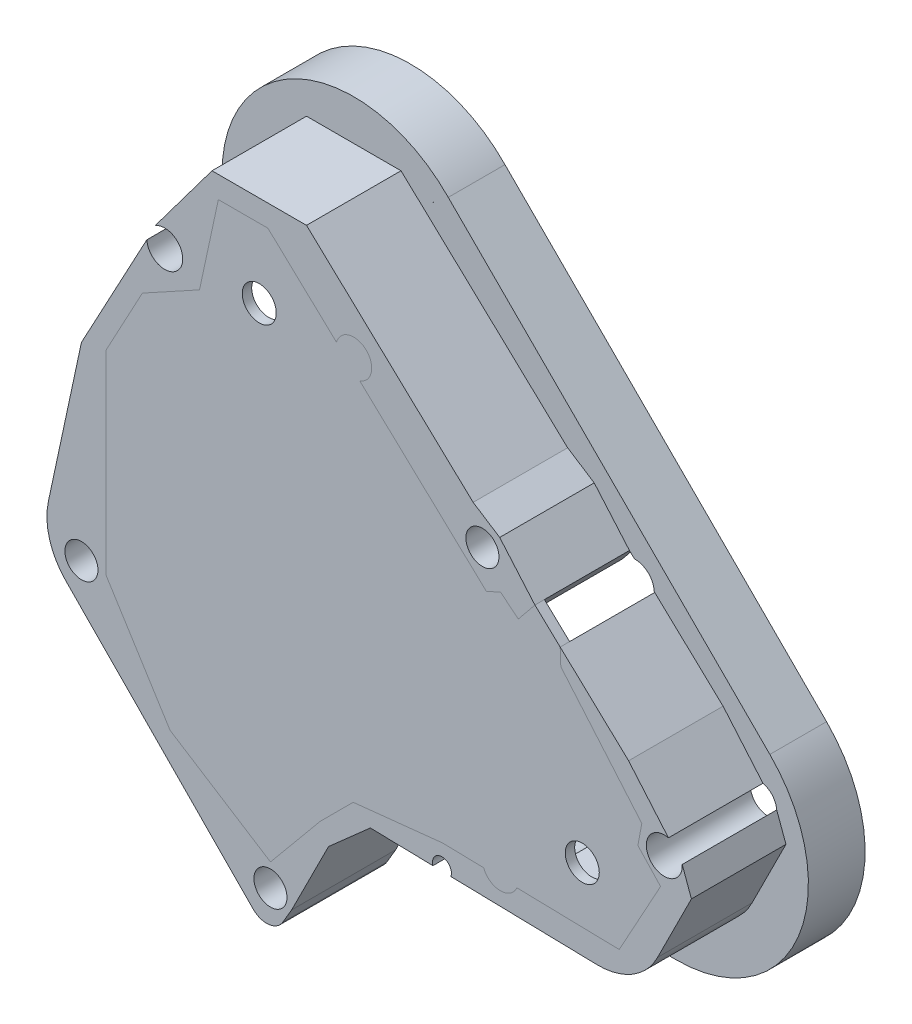
from build123d import *

# Parameters (mm, degrees)
SKETCH1_R                = 4.445
BOSS_EXTRUDE1_DEPTH      = 27.94
SKETCH1_4_R              = 4.445
SKETCH1_4_R_2            = 2.032
SKETCH1_4_R_3            = 2.0193
BOSS_EXTRUDE2_DEPTH      = 5.08
BOSS_EXTRUDE3_DEPTH      = 2.54
BOSS_EXTRUDE4_DEPTH      = 2.54
BOSS_EXTRUDE4_DEPTH_BACK = 12.7
BOSS_EXTRUDE5_DEPTH      = 2.54
CUT_EXTRUDE2_DEPTH       = 176.272405321
BOSS_EXTRUDE7_DEPTH      = 2.54
SKETCH1_7_R              = 4.572
CUT_EXTRUDE1_DEPTH       = 176.272405321
BOSS_EXTRUDE6_DEPTH      = 2.54


with BuildPart() as part:
    # Sketch1 → Boss-Extrude1 (new body)
    with BuildSketch(Plane.XY):
        with BuildLine():
            ThreePointArc((-56.507300171, 12.537235488), (-56.195803813, 3.848751471), (-51.801985551, -3.653324614))
            Line((-51.801985551, -3.653324614), (-1.47570348, -54.850767255))
            ThreePointArc((-1.47570348, -54.850767255), (2.772016994, -56.331034197), (6.529742955, -53.858421196))
            Line((6.529742955, -53.858421196), (8.86743597, -49.87006403))
            Line((8.86743597, -49.87006403), (18.794900521, -30.155662993))
            Line((18.794900521, -30.155662993), (30.015464801, -20.224261861))
            Line((30.015464801, -20.224261861), (90.906521033, -21.585518505))
            ThreePointArc((90.906521033, -21.585518505), (100.475537269, -19.041819588), (107.200283399, -11.7744772))
            Line((107.200283399, -11.7744772), (116.311189347, 6.409978492))
            Line((116.311189347, 6.409978492), (113.829291982, 13.184806868))
            ThreePointArc((113.829291982, 13.184806868), (105.340047507, 9.70868308), (110.132255745, 17.530795873))
            Line((110.132255745, 17.530795873), (99.420817942, 30.122447115))
            Line((99.420817942, 30.122447115), (81.037096807, 47.39593724))
            Line((81.037096807, 47.39593724), (81.2028603, 42.898970903))
            Line((81.2028603, 42.898970903), (102.978646989, 17.30080971))
            Line((102.978646989, 17.30080971), (101.915981854, 11.639329767))
            Line((101.915981854, 11.639329767), (108.017908886, 5.157985196))
            Line((108.017908886, 5.157985196), (96.90201237, -15.075571619))
            Line((96.90201237, -15.075571619), (69.399721914, -14.460741167))
            ThreePointArc((69.399721914, -14.460741167), (64.864546386, -17.364816007), (60.463681575, -14.260970544))
            Line((60.463681575, -14.260970544), (49.393136216, -14.01348176))
            Line((49.393136216, -14.01348176), (25.4, -16.5608))
            Line((25.4, -16.5608), (16.5608, -25.4))
            Line((16.5608, -25.4), (3.175, -41.558795918))
            Line((3.175, -41.558795918), (-23.8101989, -24.409795746))
            Line((-23.8101989, -24.409795746), (-41.068354942, 3.175))
            Line((-41.068354942, 3.175), (-41.068354942, 55.377447672))
            Line((-41.068354942, 55.377447672), (-31.251976081, 73.622391025))
            Line((-31.251976081, 73.622391025), (-15.891878201, 82.061036959))
            Line((-15.891878201, 82.061036959), (-10.836023731, 105.600550299))
            Line((-10.836023731, 105.600550299), (2.486172742, 105.600550299))
            Line((2.486172742, 105.600550299), (20.916306787, 88.283450236))
            ThreePointArc((20.916306787, 88.283450236), (28.864622049, 90.486498065), (27.160323343, 82.416522777))
            Line((27.160323343, 82.416522777), (61.243243186, 50.391941083))
            Line((61.243243186, 50.391941083), (64.972407605, 52.198379473))
            Line((64.972407605, 52.198379473), (69.788594683, 48.28291809))
            Line((69.788594683, 48.28291809), (74.25115565, 53.77206135))
            Line((74.25115565, 53.77206135), (64.777919112, 64.777919112))
            Line((64.777919112, 64.777919112), (57.647971379, 69.372544921))
            Line((57.647971379, 69.372544921), (12.859978492, 111.455698118))
            Line((12.859978492, 111.455698118), (-12.540021508, 111.455698118))
            Line((-12.540021508, 111.455698118), (-27.811486315, 91.053304566))
            ThreePointArc((-27.811486315, 91.053304566), (-20.936169847, 84.786075459), (-30.05423809, 86.632414738))
            Line((-30.05423809, 86.632414738), (-47.625, 53.975))
            Line((-47.625, 53.975), (-56.507300171, 12.537235488))
        make_face()
        with Locations((3.175, -47.625)):
            Circle(SKETCH1_R, mode=Mode.SUBTRACT)
        with Locations((-47.625, 3.175)):
            Circle(SKETCH1_R, mode=Mode.SUBTRACT)
        with Locations((60.138073453, 60.138073453)):
            Circle(SKETCH1_R, mode=Mode.SUBTRACT)
    extrude(amount=BOSS_EXTRUDE1_DEPTH)

    # Sketch1<4> → Boss-Extrude2 (add)
    # profile 1 of 3: a face of its own
    with BuildSketch(Plane.XY):
        with Locations((-47.625, 3.175)):
            Circle(SKETCH1_4_R)
        with Locations((-47.625, 3.175)):
            Circle(SKETCH1_4_R_2, mode=Mode.SUBTRACT)
    # profile 2 of 3: a face of its own
    with BuildSketch(Plane.XY):
        with Locations((3.175, -47.625)):
            Circle(SKETCH1_4_R)
        with Locations((3.175, -47.625)):
            Circle(SKETCH1_4_R_2, mode=Mode.SUBTRACT)
    # profile 3 of 3: a face of its own
    with BuildSketch(Plane.XY):
        with Locations((60.138073453, 60.138073453)):
            Circle(SKETCH1_4_R)
        with Locations((60.138073453, 60.138073453)):
            Circle(SKETCH1_4_R_3, mode=Mode.SUBTRACT)
    extrude(amount=BOSS_EXTRUDE2_DEPTH)

    # Sketch1<5> → Boss-Extrude3 (add)
    with BuildSketch(Plane.XY):
        with BuildLine():
            ThreePointArc((21.234247588, 108.745854575), (-11.894017134, 114.773008011), (-30.140021508, 86.472975741))
            Line((-30.140021508, 86.472975741), (-30.05423809, 86.632414738))
            ThreePointArc((-30.05423809, 86.632414738), (-29.543873169, 89.152830265), (-27.811486315, 91.053304566))
            Line((-27.811486315, 91.053304566), (-12.540021508, 111.455698118))
            Line((-12.540021508, 111.455698118), (12.859978492, 111.455698118))
            Line((12.859978492, 111.455698118), (57.647971379, 69.372544921))
            Line((57.647971379, 69.372544921), (64.777919112, 64.777919112))
            Line((64.777919112, 64.777919112), (74.25115565, 53.77206135))
            Line((74.25115565, 53.77206135), (75.634193234, 52.472548271))
            ThreePointArc((75.634193234, 52.472548271), (76.84224881, 52.371963391), (77.992077705, 51.988024458))
            Line((77.992077705, 51.988024458), (59.152987425, 70.827114739))
            Line((59.152987425, 70.827114739), (21.936380205, 108.043721958))
            Line((21.936380205, 108.043721958), (21.234247588, 108.745854575))
        make_face()
    extrude(amount=BOSS_EXTRUDE3_DEPTH)

    # Sketch1<6> → Boss-Extrude4 (add, two sides: drawn at the far end of the back side and taken through both)
    with BuildSketch(Plane.XY.offset(-BOSS_EXTRUDE4_DEPTH_BACK)):
        with BuildLine():
            Line((-35.220021508, 86.432971366), (-35.220021508, 77.031173063))
            Line((-35.220021508, 77.031173063), (-30.140021508, 86.472975741))
            ThreePointArc((-30.140021508, 86.472975741), (-11.894017134, 114.773008011), (21.234247588, 108.745854575))
            ThreePointArc((21.234247588, 108.745854575), (21.588189914, 108.397664284), (21.936380205, 108.043721958))
            Line((21.936380205, 108.043721958), (59.152987425, 70.827114739))
            Line((59.152987425, 70.827114739), (77.992077705, 51.988024458))
            ThreePointArc((77.992077705, 51.988024458), (79.411823143, 50.988039688), (80.411807913, 49.56829425))
            Line((80.411807913, 49.56829425), (108.394788266, 21.585313897))
            ThreePointArc((108.394788266, 21.585313897), (114.963002612, -11.435329473), (86.969452862, -30.140021416))
            Line((86.969452862, -30.140021416), (57.15, -30.140021416))
            Line((57.15, -30.140021416), (57.15, -35.220021416))
            Line((57.15, -35.220021416), (86.969452862, -35.220021416))
            ThreePointArc((86.969452862, -35.220021416), (119.656310637, -13.37936131), (111.986890715, 25.177416345))
            Line((111.986890715, 25.177416345), (62.745089873, 74.419217187))
            Line((62.745089873, 74.419217187), (25.556770339, 111.607536721))
            ThreePointArc((25.556770339, 111.607536721), (-13.380914996, 119.660069496), (-35.220021508, 86.432971366))
        make_face()
    extrude(amount=BOSS_EXTRUDE4_DEPTH + BOSS_EXTRUDE4_DEPTH_BACK)

    # Sketch1<10> → Cut-Extrude2 (cut, through all)
    with BuildSketch(Plane.XY):
        with BuildLine():
            ThreePointArc((49.319303811, -17.316116234), (47.237072506, -18.322803482), (46.834178588, -20.60025445))
            Line((46.834178588, -20.60025445), (51.655181806, -20.708030913))
            ThreePointArc((51.655181806, -20.708030913), (51.354467139, -18.414850346), (49.319303811, -17.316116234))
        make_face()
    extrude(amount=CUT_EXTRUDE2_DEPTH, mode=Mode.SUBTRACT)

    # Sketch1<11> → Boss-Extrude7 (add)
    with BuildSketch(Plane.XY):
        with BuildLine():
            Line((90.906521033, -21.585518505), (57.15, -20.83087092))
            Line((57.15, -20.83087092), (57.15, -30.140021416))
            Line((57.15, -30.140021416), (86.969452862, -30.140021416))
            ThreePointArc((86.969452862, -30.140021416), (114.963002612, -11.435329473), (108.394788266, 21.585313897))
            Line((108.394788266, 21.585313897), (80.411807913, 49.56829425))
            ThreePointArc((80.411807913, 49.56829425), (80.761514312, 48.572829693), (80.89804013, 47.526595995))
            Line((80.89804013, 47.526595995), (81.037096807, 47.39593724))
            Line((81.037096807, 47.39593724), (99.420817942, 30.122447115))
            Line((99.420817942, 30.122447115), (110.132255745, 17.530795873))
            ThreePointArc((110.132255745, 17.530795873), (112.691826368, 15.96267793), (113.829291982, 13.184806868))
            Line((113.829291982, 13.184806868), (116.311189347, 6.409978492))
            Line((116.311189347, 6.409978492), (107.200283399, -11.7744772))
            ThreePointArc((107.200283399, -11.7744772), (100.475537269, -19.041819588), (90.906521033, -21.585518505))
        make_face()
    extrude(amount=BOSS_EXTRUDE7_DEPTH)

    # Sketch1<9> → Boss-Extrude6 (add)
    with BuildSketch(Plane.XY):
        with BuildLine():
            Line((90.906521033, -21.585518505), (57.15, -20.83087092))
            Line((57.15, -20.83087092), (57.15, -30.140021416))
            Line((57.15, -30.140021416), (86.969452862, -30.140021416))
            ThreePointArc((86.969452862, -30.140021416), (114.963002612, -11.435329473), (108.394788266, 21.585313897))
            Line((108.394788266, 21.585313897), (80.411807913, 49.56829425))
            ThreePointArc((80.411807913, 49.56829425), (80.761514312, 48.572829693), (80.89804013, 47.526595995))
            Line((80.89804013, 47.526595995), (81.037096807, 47.39593724))
            Line((81.037096807, 47.39593724), (99.420817942, 30.122447115))
            Line((99.420817942, 30.122447115), (110.132255745, 17.530795873))
            ThreePointArc((110.132255745, 17.530795873), (112.691826368, 15.96267793), (113.829291982, 13.184806868))
            Line((113.829291982, 13.184806868), (116.311189347, 6.409978492))
            Line((116.311189347, 6.409978492), (107.200283399, -11.7744772))
            ThreePointArc((107.200283399, -11.7744772), (100.475537269, -19.041819588), (90.906521033, -21.585518505))
        make_face()
    extrude(amount=BOSS_EXTRUDE6_DEPTH)


with BuildPart() as body_2:
    # Sketch2 → Boss-Extrude5 (new body)
    with BuildSketch(Plane.XY.offset(27.94)):
        with BuildLine():
            Line((-10.836023731, 105.600550299), (-15.891878201, 82.061036959))
            Line((-15.891878201, 82.061036959), (-31.251976081, 73.622391025))
            Line((-31.251976081, 73.622391025), (-41.068354942, 55.377447672))
            Line((-41.068354942, 55.377447672), (-41.068354942, 3.175))
            Line((-41.068354942, 3.175), (-23.8101989, -24.409795746))
            Line((-23.8101989, -24.409795746), (3.175, -41.558795918))
            Line((3.175, -41.558795918), (16.5608, -25.4))
            Line((16.5608, -25.4), (25.4, -16.5608))
            Line((25.4, -16.5608), (49.393136216, -14.01348176))
            Line((49.393136216, -14.01348176), (60.463681575, -14.260970544))
            ThreePointArc((60.463681575, -14.260970544), (64.864546386, -17.364816007), (69.399721914, -14.460741167))
            Line((69.399721914, -14.460741167), (96.90201237, -15.075571619))
            Line((96.90201237, -15.075571619), (108.017908886, 5.157985196))
            Line((108.017908886, 5.157985196), (101.915981854, 11.639329767))
            Line((101.915981854, 11.639329767), (102.978646989, 17.30080971))
            Line((102.978646989, 17.30080971), (81.2028603, 42.898970903))
            Line((81.2028603, 42.898970903), (81.037096807, 47.39593724))
            Line((81.037096807, 47.39593724), (74.25115565, 53.77206135))
            Line((74.25115565, 53.77206135), (69.788594683, 48.28291809))
            Line((69.788594683, 48.28291809), (64.972407605, 52.198379473))
            Line((64.972407605, 52.198379473), (61.243243186, 50.391941083))
            Line((61.243243186, 50.391941083), (27.160323343, 82.416522777))
            ThreePointArc((27.160323343, 82.416522777), (28.864622049, 90.486498065), (20.916306787, 88.283450236))
            Line((20.916306787, 88.283450236), (2.486172742, 105.600550299))
            Line((2.486172742, 105.600550299), (-10.836023731, 105.600550299))
        make_face()
    extrude(amount=-BOSS_EXTRUDE5_DEPTH)

    # Sketch1<7> → Cut-Extrude1 (cut, through all)
    with BuildSketch(Plane.XY):
        with Locations((86.969452862, 0.159978492)):
            Circle(SKETCH1_7_R)
        with Locations((0.159978492, 86.969452862)):
            Circle(SKETCH1_7_R)
    extrude(amount=CUT_EXTRUDE1_DEPTH, mode=Mode.SUBTRACT)


solid = Compound([part.part, body_2.part])
